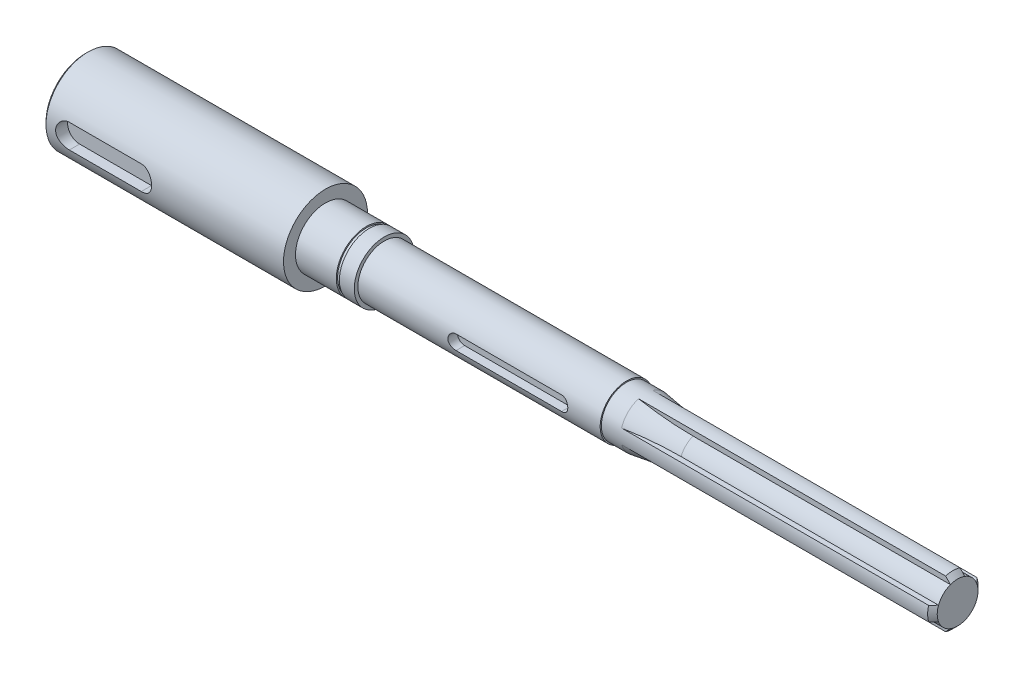
from build123d import *

# Parameters (mm, degrees)
CHAMFER_1_SIZE      = 1
CHAMFER_2_SIZE      = 2
CUT_EXTRUDE_START   = 17
SKETCH_2_OUTSIDE_W  = 110.37
SKETCH_2_OUTSIDE_H  = 110.37
SKETCH_2_OUTSIDE_R  = 11.95
CUT_EXTRUDE_1_DEPTH = 1.3
CUT_EXTRUDE_2_DEPTH = 130
FILLET_1_R          = 130
CUT_EXTRUDE_START_2 = 7
CUT_EXTRUDE_3_DEPTH = 358.341529437
CUT_EXTRUDE_START_3 = 12.5
CUT_EXTRUDE_4_DEPTH = 352.841529437


with BuildPart() as part:
    # 草图1 → 旋转1 (revolve)
    with BuildSketch(Plane.XY):
        Polygon((0, 0), (0, 17.5), (100, 17.5), (100, 12.5), (124.5, 12.5), (124.5, 11), (225.5, 11), (225.5, 10.5), (363.5, 10.5), (363.5, 0), align=None)
    revolve(axis=Axis((363.5, 0, 0), (-1, 0, 0)))

    # 倒角1
    chamfer_1_edges = [part.edges().sort_by_distance(p)[0] for p in [
        (0, -17.5, 0),
    ]]
    chamfer(chamfer_1_edges, length=CHAMFER_1_SIZE)

    # 倒角2
    chamfer_2_edges = [part.edges().sort_by_distance(p)[0] for p in [
        (363.5, -10.5, 0),
    ]]
    chamfer(chamfer_2_edges, length=CHAMFER_2_SIZE)

    # 草图2 outside → 切除-拉伸1 (cut)
    with BuildSketch(Plane(origin=(100, 0, 0), x_dir=(0, 0, -1), z_dir=(1, 0, 0)).offset(CUT_EXTRUDE_START)):
        Rectangle(SKETCH_2_OUTSIDE_W, SKETCH_2_OUTSIDE_H)
        with Locations(Location((0, 0, 0), (0, 0, 90))):
            Circle(SKETCH_2_OUTSIDE_R, mode=Mode.SUBTRACT)
    extrude(amount=CUT_EXTRUDE_1_DEPTH, mode=Mode.SUBTRACT)

    # 草图3 → 切除-拉伸2 (cut)
    with BuildSketch(Plane(origin=(363.5, 0, 0), x_dir=(0, 0, -1), z_dir=(1, 0, 0))):
        with BuildLine():
            Line((-10.062305899, 3), (-7.95298686, 3))
            ThreePointArc((-7.95298686, 3), (-6.01040764, 6.01040764), (-3, 7.95298686))
            Line((-3, 7.95298686), (-3, 10.062305899))
            ThreePointArc((-3, 10.062305899), (-7.424621202, 7.424621202), (-10.062305899, 3))
        make_face()
        with BuildLine():
            Line((3, 10.062305899), (3, 7.95298686))
            ThreePointArc((3, 7.95298686), (6.01040764, 6.01040764), (7.95298686, 3))
            Line((7.95298686, 3), (10.062305899, 3))
            ThreePointArc((10.062305899, 3), (7.424621202, 7.424621202), (3, 10.062305899))
        make_face()
        with BuildLine():
            ThreePointArc((7.95298686, -3), (6.01040764, -6.01040764), (3, -7.95298686))
            Line((3, -7.95298686), (3, -10.062305899))
            ThreePointArc((3, -10.062305899), (7.424621202, -7.424621202), (10.062305899, -3))
            Line((10.062305899, -3), (7.95298686, -3))
        make_face()
        with BuildLine():
            ThreePointArc((-10.062305899, -3), (-7.424621202, -7.424621202), (-3, -10.062305899))
            Line((-3, -10.062305899), (-3, -7.95298686))
            ThreePointArc((-3, -7.95298686), (-6.01040764, -6.01040764), (-7.95298686, -3))
            Line((-7.95298686, -3), (-10.062305899, -3))
        make_face()
    extrude(amount=-CUT_EXTRUDE_2_DEPTH, mode=Mode.SUBTRACT)

    # 圆角1
    # the kernel refuses this fillet: 130 mm, written as the material it adds along each edge
    with BuildSketch(Plane(origin=(233.5, 0, 0), x_dir=(0, 0.7048818539423689, -0.7093247295722663), z_dir=(0, 0.7093247295722663, 0.7048818539423689))) as fillet_1_piece_1:
        with BuildLine():
            CenterArc((138.5, -22.715633383), FILLET_1_R, 169.936725557, 10.063274443)
            Line((10.5, 0), (8.5, 0))
            Line((8.5, 0), (8.5, -22.715633383))
        make_face()
    revolve(axis=Axis((233.5, 0, 0), (-1, 0, 0)), revolution_arc=359.64)
    with BuildSketch(Plane(origin=(233.5, 0, 0), x_dir=(0, 0.7093247295722621, 0.7048818539423733), z_dir=(0, -0.7048818539423733, 0.7093247295722621))) as fillet_1_piece_2:
        with BuildLine():
            CenterArc((138.5, -22.715633383), FILLET_1_R, 169.936725557, 10.063274443)
            Line((10.5, 0), (8.5, 0))
            Line((8.5, 0), (8.5, -22.715633383))
        make_face()
    revolve(axis=Axis((233.5, 0, 0), (-1, 0, 0)), revolution_arc=359.64)
    with BuildSketch(Plane(origin=(233.5, 0, 0), x_dir=(0, -0.7048818539423463, 0.7093247295722888), z_dir=(0, -0.7093247295722888, -0.7048818539423463))) as fillet_1_piece_3:
        with BuildLine():
            CenterArc((138.5, -22.715633383), FILLET_1_R, 169.936725557, 10.063274443)
            Line((10.5, 0), (8.5, 0))
            Line((8.5, 0), (8.5, -22.715633383))
        make_face()
    revolve(axis=Axis((233.5, 0, 0), (-1, 0, 0)), revolution_arc=359.64)
    with BuildSketch(Plane(origin=(233.5, 0, 0), x_dir=(0, -0.7093247295722879, -0.7048818539423474), z_dir=(0, 0.7048818539423474, -0.7093247295722879))) as fillet_1_piece_4:
        with BuildLine():
            CenterArc((138.5, -22.715633383), FILLET_1_R, 169.936725557, 10.063274443)
            Line((10.5, 0), (8.5, 0))
            Line((8.5, 0), (8.5, -22.715633383))
        make_face()
    revolve(axis=Axis((233.5, 0, 0), (-1, 0, 0)), revolution_arc=359.64)

    # 草图4 → 切除-拉伸3 (cut, through all)
    with BuildSketch(Plane.XY.offset(CUT_EXTRUDE_START_2)):
        with BuildLine():
            Line((165, 3), (209, 3))
            ThreePointArc((209, 3), (212, 0), (209, -3))
            Line((209, -3), (165, -3))
            ThreePointArc((165, -3), (162, 0), (165, 3))
        make_face()
    extrude(amount=CUT_EXTRUDE_3_DEPTH, mode=Mode.SUBTRACT)

    # 草图5 → 切除-拉伸4 (cut, through all)
    with BuildSketch(Plane.XY.offset(CUT_EXTRUDE_START_3)):
        with BuildLine():
            Line((10, 5), (40, 5))
            ThreePointArc((40, 5), (45, 0), (40, -5))
            Line((40, -5), (10, -5))
            ThreePointArc((10, -5), (5, 0), (10, 5))
        make_face()
    extrude(amount=CUT_EXTRUDE_4_DEPTH, mode=Mode.SUBTRACT)


solid = part.part
